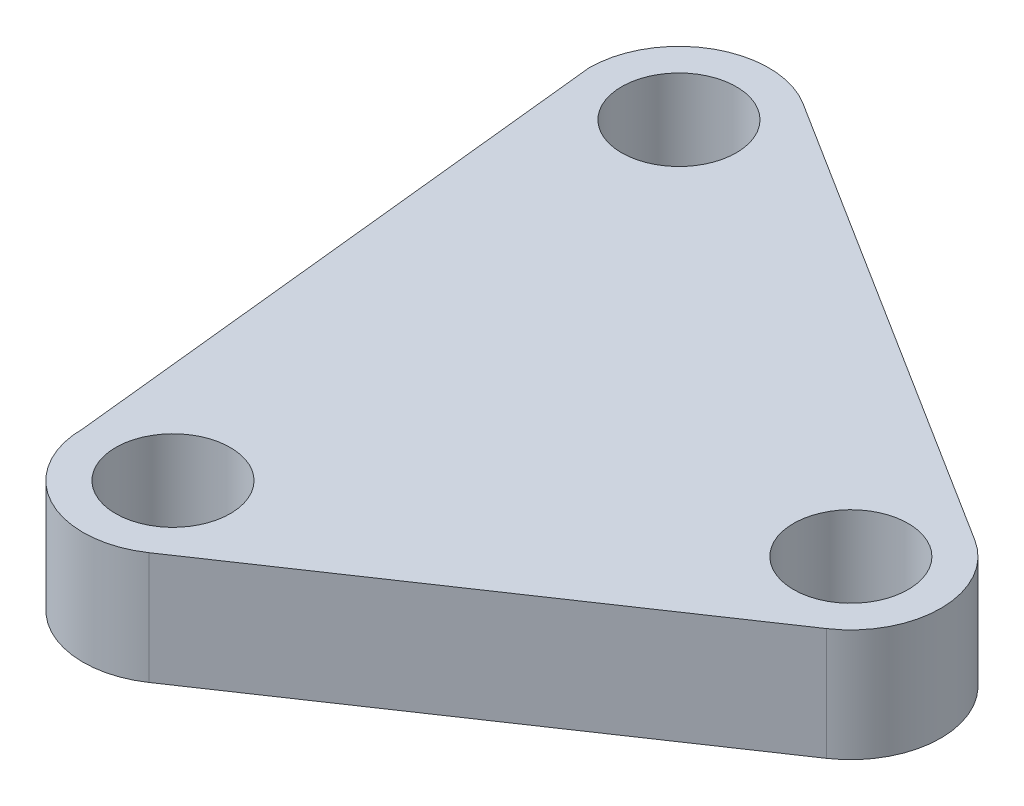
from build123d import *

# Parameters (mm, degrees)
SKETCH1_R           = 2.55
BOSS_EXTRUDE1_DEPTH = 5


with BuildPart() as part:
    # Sketch1 → Boss-Extrude1 (new body)
    with BuildSketch(Plane(origin=(0, 0, 0), x_dir=(1, 0, 0), z_dir=(0, 1, 0))):
        with BuildLine():
            Line((22.777022974, -9.615133422), (2.131355964, 3.384866578))
            ThreePointArc((2.131355964, 3.384866578), (-1.933206681, 3.501815519), (-4, 0))
            Line((-4, 0), (-1.35433299, -25.15))
            ThreePointArc((-1.35433299, -25.15), (0.768377165, -28.682107422), (4.88355843, -28.465394696))
            Line((4.88355843, -28.465394696), (22.88355843, -16.315394696))
            ThreePointArc((22.88355843, -16.315394696), (24.645161473, -12.936407261), (22.777022974, -9.615133422))
        make_face()
        with Locations((20.64566701, -13)):
            Circle(SKETCH1_R, mode=Mode.SUBTRACT)
        with Locations((2.64566701, -25.15)):
            Circle(SKETCH1_R, mode=Mode.SUBTRACT)
        Circle(SKETCH1_R, mode=Mode.SUBTRACT)
    extrude(amount=BOSS_EXTRUDE1_DEPTH)


solid = part.part
